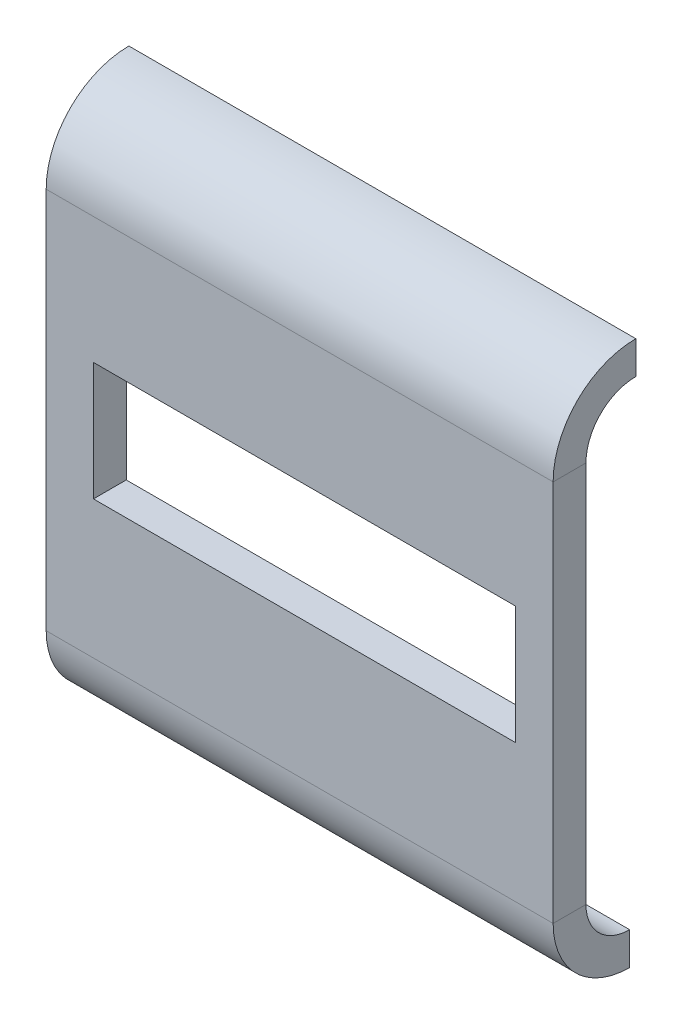
from build123d import *

# Parameters (mm, degrees)
SKETCH1_W              = 166.217523153
SKETCH1_H              = 177.56469515
BOSS_EXTRUDE1_DEPTH    = 2.54
CONVERT_SOLID1_START   = -79.335378531
CONVERT_SOLID1_DEPTH   = 166.217523153
CONVERT_SOLID1_2_DEPTH = 166.217523153
SKETCH9_W              = 138.38791167
SKETCH9_H              = 38.762646995
CUT_EXTRUDE1_DEPTH     = 128.40199345


# Read off the part's stored shape, not the designer's step: Convert-Solid1
with BuildPart() as part:
    # Sketch1 → Boss-Extrude1 (new body)
    with BuildSketch(Plane.XY):
        with Locations((3.773383045, -0.367528123)):
            Rectangle(SKETCH1_W, SKETCH1_H)
    extrude(amount=BOSS_EXTRUDE1_DEPTH)

    # Convert-Solid1 outline → Convert-Solid1 (cut)
    with BuildSketch(Plane.YZ.offset(CONVERT_SOLID1_START)):
        with BuildLine():
            Line((-89.149875698, 0), (-75.067820962, 0))
            ThreePointArc((-75.067820962, 0), (-69.713597874, 1.896751012), (-64.069875698, 2.54))
            Line((-64.069875698, 2.54), (-89.149875698, 2.54))
            Line((-89.149875698, 2.54), (-89.149875698, 0))
        make_face()
        with BuildLine():
            ThreePointArc((61.302819452, 2.54), (67.170718566, 1.897384277), (72.760452717, 0))
            Line((72.760452717, 0), (88.414819452, 0))
            Line((88.414819452, 0), (88.414819452, 2.54))
            Line((88.414819452, 2.54), (61.302819452, 2.54))
        make_face()
    extrude(amount=CONVERT_SOLID1_DEPTH, mode=Mode.SUBTRACT)

    # Convert-Solid1 2 outline → Convert-Solid1 2 (add)
    with BuildSketch(Plane.YZ.offset(CONVERT_SOLID1_START)):
        with BuildLine():
            ThreePointArc((-75.067820962, 0), (-85.339982271, -9.251321871), (-89.149875698, -22.54))
            Line((-89.149875698, -22.54), (-78.387875698, -22.54))
            ThreePointArc((-78.387875698, -22.54), (-74.194230592, -12.415645107), (-64.069875698, -8.222))
            Line((-64.069875698, -8.222), (61.302819452, -8.222))
            ThreePointArc((61.302819452, -8.222), (72.864015325, -13.010804128), (77.652819452, -24.572))
            Line((77.652819452, -24.572), (88.414819452, -24.572))
            ThreePointArc((88.414819452, -24.572), (84.168731823, -10.004550138), (72.760452717, 0))
            Line((72.760452717, 0), (-75.067820962, 0))
        make_face()
    extrude(amount=CONVERT_SOLID1_2_DEPTH)

    # Sketch9 → Cut-Extrude1 (cut, through all)
    with BuildSketch(Plane.XY.offset(2.54)):
        with Locations((5.35195238, 0.49679134)):
            Rectangle(SKETCH9_W, SKETCH9_H)
    extrude(amount=-CUT_EXTRUDE1_DEPTH, mode=Mode.SUBTRACT)


solid = part.part
